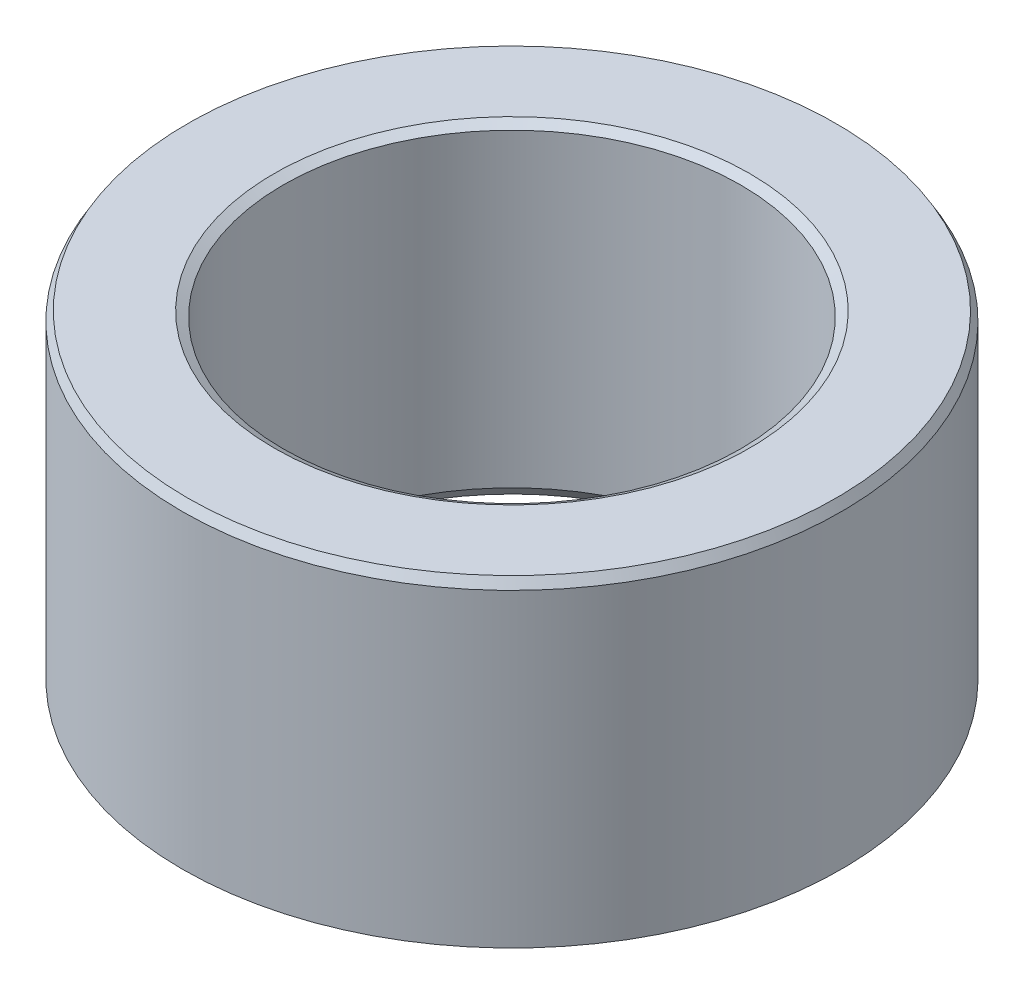
from build123d import *
from OCP.BRepFilletAPI import BRepFilletAPI_MakeChamfer

# Parameters (mm, degrees)
SKETCH1_R           = 12.5
BOSS_EXTRUDE1_DEPTH = 12.293404202
SKETCH2_R           = 8.673435814
CUT_EXTRUDE1_DEPTH  = 22.532017715
CHAMFER1_SIZE       = 0.346346095
CHAMFER1_SIZE2      = 0.199963011


with BuildPart() as part:
    # Sketch1 → Boss-Extrude1 (new body)
    with BuildSketch(Plane(origin=(0, 0, 0), x_dir=(1, 0, 0), z_dir=(0, 1, 0))):
        Circle(SKETCH1_R)
    extrude(amount=BOSS_EXTRUDE1_DEPTH)

    # Sketch2 → Cut-Extrude1 (cut, through all)
    with BuildSketch(Plane(origin=(0, 0, 0), x_dir=(1, 0, 0), z_dir=(0, 1, 0))):
        Circle(SKETCH2_R)
    extrude(amount=CUT_EXTRUDE1_DEPTH, mode=Mode.SUBTRACT)

    # Chamfer1: one chamfer whose edges measure the first distance from different faces: ONE call of the kernel's chamfer builder (chamfer() names one face for all edges)
    chamfer1_edges_1 = [part.edges().sort_by_distance(p)[0] for p in [
        (-8.673435814, 12.293404202, 0),
    ]]
    chamfer1_side_1 = [part.faces().sort_by_distance(p)[0] for p in [
        (-12.146446609, 12.293404202, 0),
    ]]
    chamfer1_edges_2 = [part.edges().sort_by_distance(p)[0] for p in [
        (-8.673435814, 0, 0),
    ]]
    chamfer1_side_2 = [part.faces().sort_by_distance(p)[0] for p in [
        (-8.673435814, 6.146702101, 0),
    ]]
    chamfer1_edges_3 = [part.edges().sort_by_distance(p)[0] for p in [
        (-12.5, 0, 0),
    ]]
    chamfer1_side_3 = [part.faces().sort_by_distance(p)[0] for p in [
        (-12.146446609, 0, 0),
    ]]
    chamfer1_edges_4 = [part.edges().sort_by_distance(p)[0] for p in [
        (-12.5, 12.293404202, 0),
    ]]
    chamfer1_side_4 = [part.faces().sort_by_distance(p)[0] for p in [
        (-12.5, 6.146702101, 0),
    ]]
    chamfer1 = BRepFilletAPI_MakeChamfer(part.part.solid().wrapped)
    for e in chamfer1_edges_1:
        chamfer1.Add(CHAMFER1_SIZE, CHAMFER1_SIZE2, e.wrapped, chamfer1_side_1[0].wrapped)  # the first distance lies on this face
    for e in chamfer1_edges_2:
        chamfer1.Add(CHAMFER1_SIZE, CHAMFER1_SIZE2, e.wrapped, chamfer1_side_2[0].wrapped)  # the first distance lies on this face
    for e in chamfer1_edges_3:
        chamfer1.Add(CHAMFER1_SIZE, CHAMFER1_SIZE2, e.wrapped, chamfer1_side_3[0].wrapped)  # the first distance lies on this face
    for e in chamfer1_edges_4:
        chamfer1.Add(CHAMFER1_SIZE, CHAMFER1_SIZE2, e.wrapped, chamfer1_side_4[0].wrapped)  # the first distance lies on this face
    add(Compound.cast(chamfer1.Shape()), mode=Mode.REPLACE)


solid = part.part
